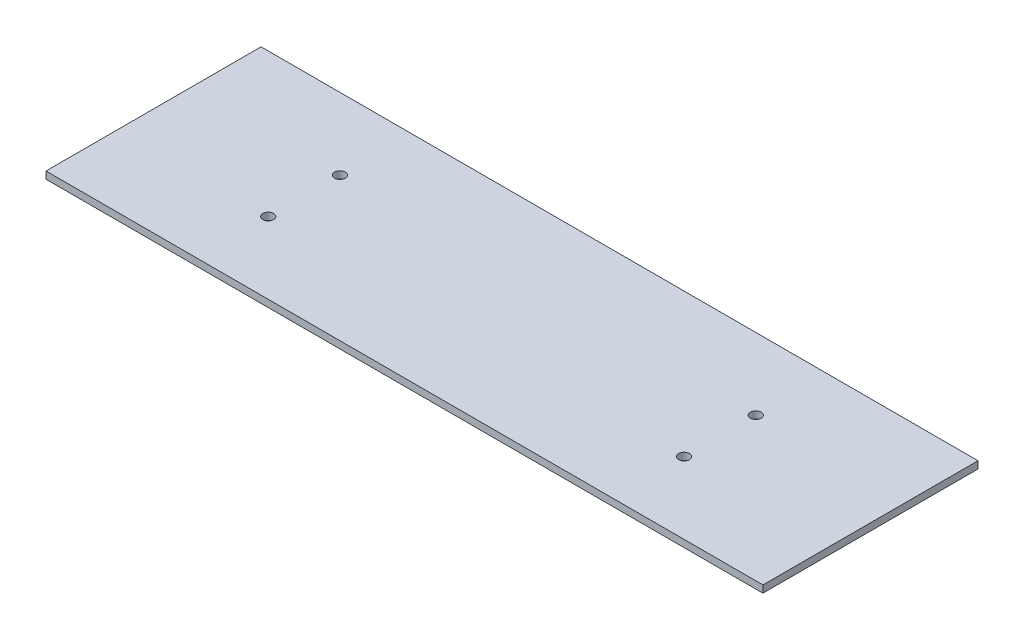
from build123d import *

# Parameters (mm, degrees)
SKETCH1_W           = 200
SKETCH1_H           = 60
SKETCH1_R           = 1.5
BOSS_EXTRUDE1_DEPTH = 2


with BuildPart() as part:
    # Sketch1 → Boss-Extrude1 (new body)
    with BuildSketch(Plane(origin=(0, 0, 0), x_dir=(1, 0, 0), z_dir=(0, 1, 0))):
        with Locations((100, 30)):
            Rectangle(SKETCH1_W, SKETCH1_H)
        with Locations((42, 40)):
            Circle(SKETCH1_R, mode=Mode.SUBTRACT)
        with Locations((42, 20)):
            Circle(SKETCH1_R, mode=Mode.SUBTRACT)
        with Locations((158, 20)):
            Circle(SKETCH1_R, mode=Mode.SUBTRACT)
        with Locations((158, 40)):
            Circle(SKETCH1_R, mode=Mode.SUBTRACT)
    extrude(amount=BOSS_EXTRUDE1_DEPTH)


solid = part.part
